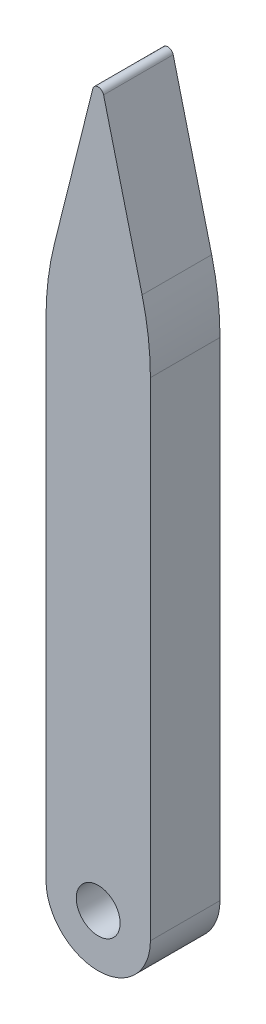
from build123d import *

# Parameters (mm, degrees)
SKETCH1_R           = 0.5
BOSS_EXTRUDE1_DEPTH = 1.5875
FILLET1_R           = 6.35
FILLET2_R           = 0.127


with BuildPart() as part:
    # Sketch1 → Boss-Extrude1 (new body)
    with BuildSketch(Plane.XY):
        with BuildLine():
            Line((-1.190625, -6), (-1.190625, 5.90625))
            Line((-1.190625, 5.90625), (0, 10.66875))
            Line((0, 10.66875), (1.190625, 5.90625))
            Line((1.190625, 5.90625), (1.190625, -6))
            ThreePointArc((1.190625, -6), (0, -7.190625), (-1.190625, -6))
        make_face()
        with Locations((0, -6)):
            Circle(SKETCH1_R, mode=Mode.SUBTRACT)
    extrude(amount=-BOSS_EXTRUDE1_DEPTH)

    # Fillet1
    fillet1_edges = [part.edges().sort_by_distance(p)[0] for p in [
        (1.190625, 5.90625, -0.79375),
        (-1.190625, 5.90625, -0.79375),
    ]]
    fillet(fillet1_edges, radius=FILLET1_R)

    # Fillet2
    fillet2_edges = [part.edges().sort_by_distance(p)[0] for p in [
        (0, 10.66875, -0.79375),
    ]]
    fillet(fillet2_edges, radius=FILLET2_R)


solid = part.part
